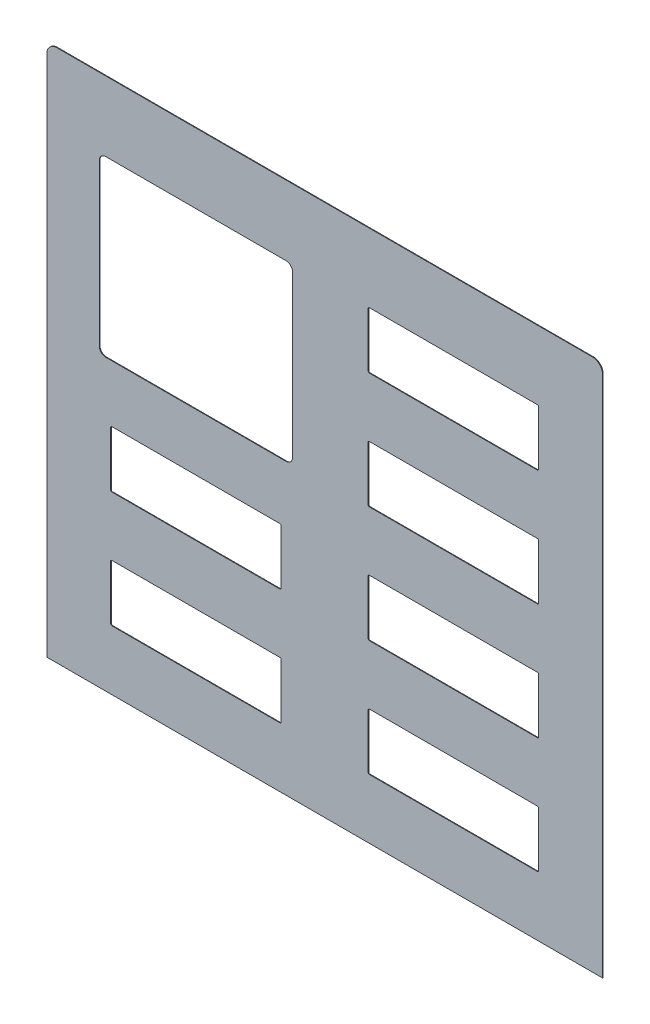
from build123d import *

# Parameters (mm, degrees)
BASE_FLANGE1_DEPTH = 1
CUT_EXTRUDE1_DEPTH = 10
CUT_EXTRUDE2_DEPTH = 10


# Sheet-metal steps are written as plain solids
with BuildPart() as part:
    # Sketch1 → Base-Flange1 (new body)
    with BuildSketch(Plane.XY):
        with BuildLine():
            Line((0, 0), (863.4, 0))
            Line((863.4, 0), (863.4, 812))
            ThreePointArc((863.4, 812), (858.801576465, 823.101576465), (847.7, 827.7))
            Line((847.7, 827.7), (15.7, 827.7))
            ThreePointArc((15.7, 827.7), (4.598423535, 823.101576465), (0, 812))
            Line((0, 812), (0, 0))
        make_face()
    extrude(amount=-BASE_FLANGE1_DEPTH)

    # Sketch9 → Cut-Extrude1 (cut)
    with BuildSketch(Plane.XY):
        with BuildLine():
            Line((762.2, 720.7), (501.2, 720.7))
            ThreePointArc((501.2, 720.7), (499.785786438, 720.114213562), (499.2, 718.7))
            Line((499.2, 718.7), (499.2, 634.7))
            ThreePointArc((499.2, 634.7), (499.785786438, 633.285786438), (501.2, 632.7))
            Line((501.2, 632.7), (762.2, 632.7))
            ThreePointArc((762.2, 632.7), (763.614213562, 633.285786438), (764.2, 634.7))
            Line((764.2, 634.7), (764.2, 718.7))
            ThreePointArc((764.2, 718.7), (763.614213562, 720.114213562), (762.2, 720.7))
        make_face()
        with BuildLine():
            Line((764.2, 538.7), (764.2, 454.7))
            ThreePointArc((764.2, 454.7), (763.614213562, 453.285786438), (762.2, 452.7))
            Line((762.2, 452.7), (501.2, 452.7))
            ThreePointArc((501.2, 452.7), (499.785786438, 453.285786438), (499.2, 454.7))
            Line((499.2, 454.7), (499.2, 538.7))
            ThreePointArc((499.2, 538.7), (499.785786438, 540.114213562), (501.2, 540.7))
            Line((501.2, 540.7), (762.2, 540.7))
            ThreePointArc((762.2, 540.7), (763.614213562, 540.114213562), (764.2, 538.7))
        make_face()
        with BuildLine():
            Line((764.2, 358.7), (764.2, 274.7))
            ThreePointArc((764.2, 274.7), (763.614213562, 273.285786438), (762.2, 272.7))
            Line((762.2, 272.7), (501.2, 272.7))
            ThreePointArc((501.2, 272.7), (499.785786438, 273.285786438), (499.2, 274.7))
            Line((499.2, 274.7), (499.2, 358.7))
            ThreePointArc((499.2, 358.7), (499.785786438, 360.114213562), (501.2, 360.7))
            Line((501.2, 360.7), (762.2, 360.7))
            ThreePointArc((762.2, 360.7), (763.614213562, 360.114213562), (764.2, 358.7))
        make_face()
        with BuildLine():
            Line((764.2, 178.7), (764.2, 94.7))
            ThreePointArc((764.2, 94.7), (763.614213562, 93.285786438), (762.2, 92.7))
            Line((762.2, 92.7), (501.2, 92.7))
            ThreePointArc((501.2, 92.7), (499.785786438, 93.285786438), (499.2, 94.7))
            Line((499.2, 94.7), (499.2, 178.7))
            ThreePointArc((499.2, 178.7), (499.785786438, 180.114213562), (501.2, 180.7))
            Line((501.2, 180.7), (762.2, 180.7))
            ThreePointArc((762.2, 180.7), (763.614213562, 180.114213562), (764.2, 178.7))
        make_face()
        with BuildLine():
            Line((364.2, 358.7), (364.2, 274.7))
            ThreePointArc((364.2, 274.7), (363.614213562, 273.285786438), (362.2, 272.7))
            Line((362.2, 272.7), (101.2, 272.7))
            ThreePointArc((101.2, 272.7), (99.785786438, 273.285786438), (99.2, 274.7))
            Line((99.2, 274.7), (99.2, 358.7))
            ThreePointArc((99.2, 358.7), (99.785786438, 360.114213562), (101.2, 360.7))
            Line((101.2, 360.7), (362.2, 360.7))
            ThreePointArc((362.2, 360.7), (363.614213562, 360.114213562), (364.2, 358.7))
        make_face()
        with BuildLine():
            Line((364.2, 178.7), (364.2, 94.7))
            ThreePointArc((364.2, 94.7), (363.614213562, 93.285786438), (362.2, 92.7))
            Line((362.2, 92.7), (101.2, 92.7))
            ThreePointArc((101.2, 92.7), (99.785786438, 93.285786438), (99.2, 94.7))
            Line((99.2, 94.7), (99.2, 178.7))
            ThreePointArc((99.2, 178.7), (99.785786438, 180.114213562), (101.2, 180.7))
            Line((101.2, 180.7), (362.2, 180.7))
            ThreePointArc((362.2, 180.7), (363.614213562, 180.114213562), (364.2, 178.7))
        make_face()
    extrude(amount=-CUT_EXTRUDE1_DEPTH, mode=Mode.SUBTRACT)

    # Sketch10 → Cut-Extrude2 (cut)
    with BuildSketch(Plane.XY):
        with BuildLine():
            Line((91.7, 449.2), (371.7, 449.2))
            ThreePointArc((371.7, 449.2), (378.771067812, 452.128932188), (381.7, 459.2))
            Line((381.7, 459.2), (381.7, 709.2))
            ThreePointArc((381.7, 709.2), (378.771067812, 716.271067812), (371.7, 719.2))
            Line((371.7, 719.2), (91.7, 719.2))
            ThreePointArc((91.7, 719.2), (84.628932188, 716.271067812), (81.7, 709.2))
            Line((81.7, 709.2), (81.7, 459.2))
            ThreePointArc((81.7, 459.2), (84.628932188, 452.128932188), (91.7, 449.2))
        make_face()
    extrude(amount=-CUT_EXTRUDE2_DEPTH, mode=Mode.SUBTRACT)


solid = part.part
